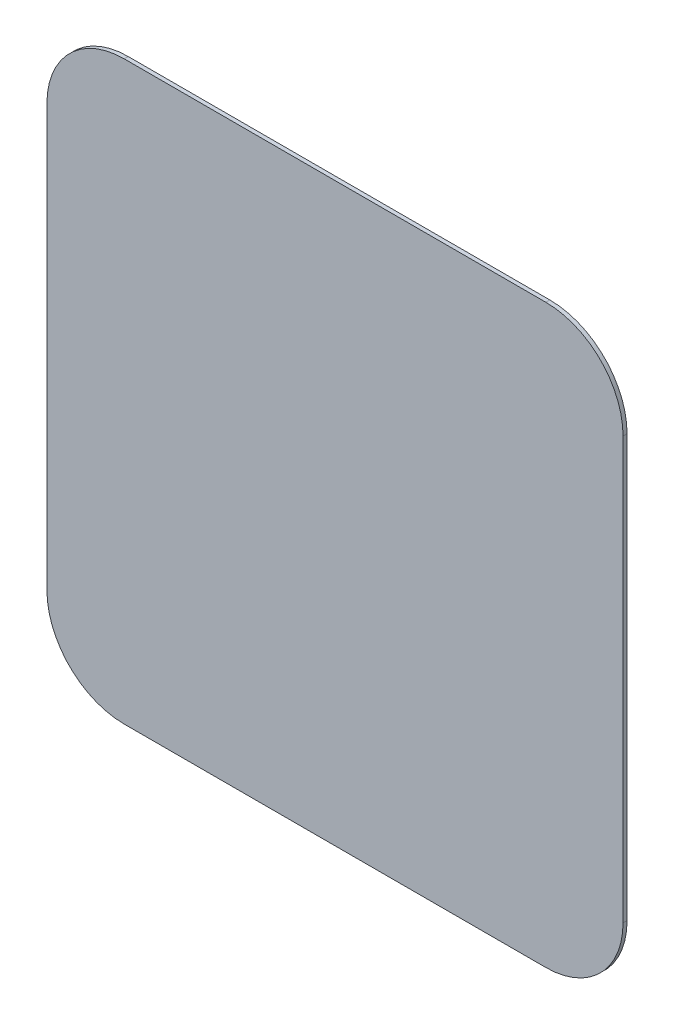
from build123d import *

# Parameters (mm, degrees)
AUFSATZ_LINEAR_AUSTRAGEN1_DEPTH = 0.2


with BuildPart() as part:
    # Skizze1 → Aufsatz-Linear austragen1 (new body)
    with BuildSketch(Plane.XY):
        with BuildLine():
            ThreePointArc((-10.5, 14.35), (-13.222361108, 13.222361108), (-14.35, 10.5))
            Line((-14.35, 10.5), (-14.35, -10.5))
            ThreePointArc((-14.35, -10.5), (-13.222361108, -13.222361108), (-10.5, -14.35))
            Line((-10.5, -14.35), (10.5, -14.35))
            ThreePointArc((10.5, -14.35), (13.222361108, -13.222361108), (14.35, -10.5))
            Line((14.35, -10.5), (14.35, 10.5))
            ThreePointArc((14.35, 10.5), (13.222361108, 13.222361108), (10.5, 14.35))
            Line((10.5, 14.35), (-10.5, 14.35))
        make_face()
    extrude(amount=AUFSATZ_LINEAR_AUSTRAGEN1_DEPTH)


solid = part.part
